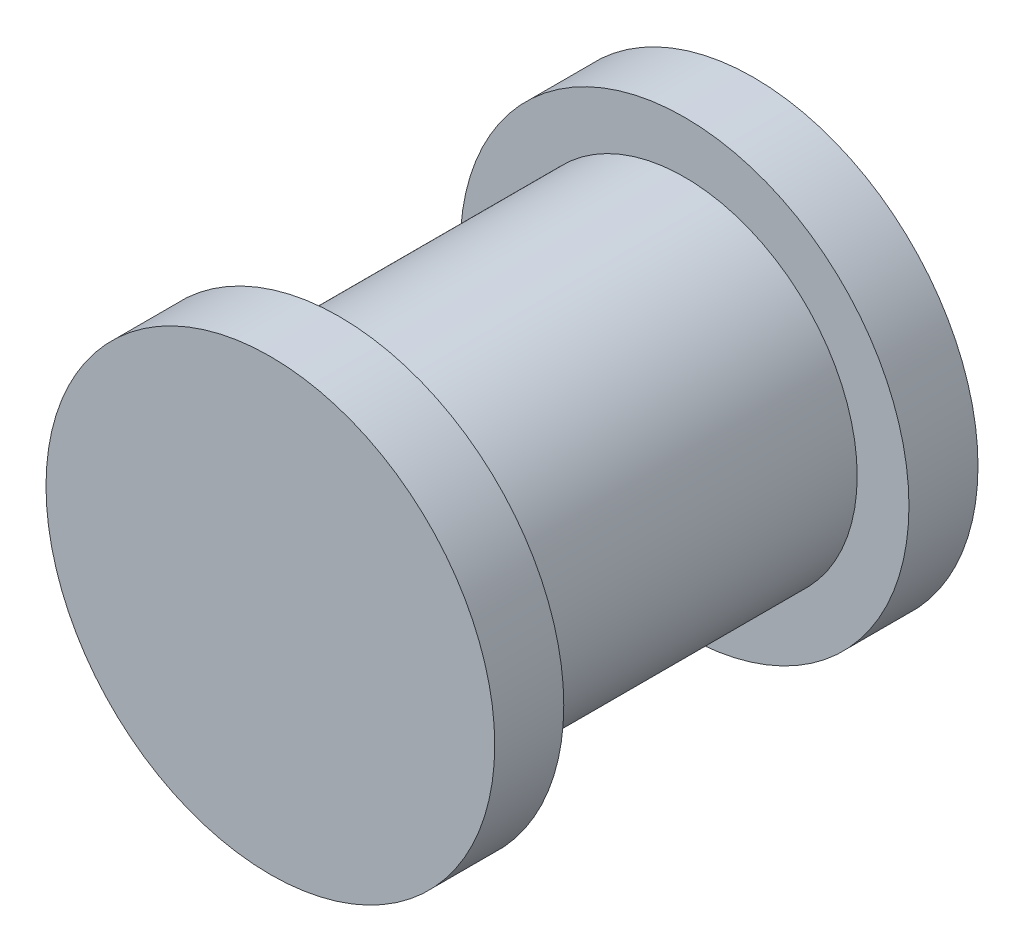
from build123d import *

# Parameters (mm, degrees)
SKETCH1_R           = 250
BOSS_EXTRUDE1_DEPTH = 500
SKETCH2_R           = 325
BOSS_EXTRUDE2_DEPTH = 100
BOSS_EXTRUDE3_START = 100
SKETCH3_R           = 325
BOSS_EXTRUDE3_DEPTH = 100


with BuildPart() as part:
    # Sketch1 → Boss-Extrude1 (new body)
    with BuildSketch(Plane.XY):
        Circle(SKETCH1_R)
    extrude(amount=BOSS_EXTRUDE1_DEPTH)

    # Sketch2 → Boss-Extrude2 (add)
    with BuildSketch(Plane.XY.offset(500)):
        Circle(SKETCH2_R)
    extrude(amount=BOSS_EXTRUDE2_DEPTH)

    # Sketch3 → Boss-Extrude3 (add)
    with BuildSketch(Plane(origin=(0, 0, 0), x_dir=(-1, 0, 0), z_dir=(0, 0, -1)).offset(BOSS_EXTRUDE3_START)):
        Circle(SKETCH3_R)
    extrude(amount=-BOSS_EXTRUDE3_DEPTH)


solid = part.part
